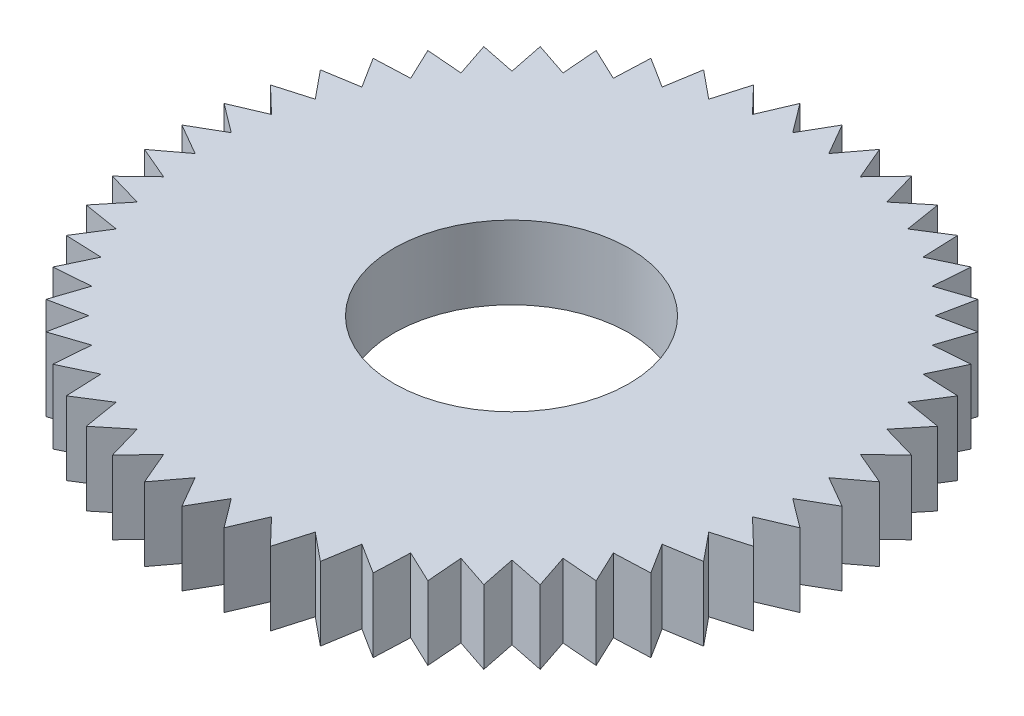
from build123d import *

# Parameters (mm, degrees)
SKETCH1_R           = 4
BOSS_EXTRUDE1_DEPTH = 2.5


with BuildPart() as part:
    # Sketch1 → Boss-Extrude1 (new body)
    with BuildSketch(Plane(origin=(0, 0, 0), x_dir=(1, 0, 0), z_dir=(0, 1, 0))):
        Polygon((0, 11.2593364), (-0.615569479, 10.193138786), (-1.355166685, 11.177363917), (-1.837732048, 10.044741383), (-2.690571988, 10.932641813), (-3.033096346, 9.750110546), (-3.986742692, 10.528738687), (-4.184231269, 9.313542654), (-5.224777711, 9.971544355), (-5.274350679, 8.741403853), (-6.386623706, 9.269183966), (-6.287558178, 8.042037212), (-7.455338345, 8.431899516), (-7.209078921, 7.225641073), (-8.415337364, 7.471900497), (-8.02547506, 6.30412033), (-9.252621814, 6.403185858), (-8.7248417, 5.290912831), (-9.954982203, 5.241339863), (-9.296980502, 4.200793422), (-10.512176534, 4.003304844), (-9.733548394, 3.049658499), (-10.916079661, 2.70713414), (-10.028179231, 1.854294201), (-11.160801765, 1.371728837), (-10.176576634, 0.632131631), (-11.242774248, 0.016562152), (-10.176576634, -0.599007327), (-11.160801765, -1.338604532), (-10.028179231, -1.821169896), (-10.916079661, -2.674009835), (-9.733548394, -3.016534194), (-10.512176534, -3.97018054), (-9.296980502, -4.167669117), (-9.954982203, -5.208215559), (-8.7248417, -5.257788526), (-9.252621814, -6.370061553), (-8.02547506, -6.270996026), (-8.415337364, -7.438776193), (-7.209078921, -7.192516769), (-7.455338345, -8.398775211), (-6.287558178, -8.008912907), (-6.386623706, -9.236059661), (-5.274350679, -8.708279548), (-5.224777711, -9.93842005), (-4.184231269, -9.28041835), (-3.986742692, -10.495614382), (-3.033096346, -9.716986241), (-2.690571988, -10.899517509), (-1.837732048, -10.011617079), (-1.355166685, -11.144239613), (-0.615569479, -10.160014482), (0, -11.226212095), (0.615569479, -10.160014482), (1.355166685, -11.144239613), (1.837732048, -10.011617079), (2.690571988, -10.899517509), (3.033096346, -9.716986241), (3.986742692, -10.495614382), (4.184231269, -9.28041835), (5.224777711, -9.93842005), (5.274350679, -8.708279548), (6.386623706, -9.236059661), (6.287558178, -8.008912907), (7.455338345, -8.398775211), (7.209078921, -7.192516769), (8.415337364, -7.438776193), (8.02547506, -6.270996026), (9.252621814, -6.370061553), (8.7248417, -5.257788526), (9.954982203, -5.208215559), (9.296980502, -4.167669117), (10.512176534, -3.97018054), (9.733548394, -3.016534194), (10.916079661, -2.674009835), (10.028179231, -1.821169896), (11.160801765, -1.338604532), (10.176576634, -0.599007327), (11.242774248, 0.016562152), (10.176576634, 0.632131631), (11.160801765, 1.371728837), (10.028179231, 1.854294201), (10.916079661, 2.70713414), (9.733548394, 3.049658499), (10.512176534, 4.003304844), (9.296980502, 4.200793422), (9.954982203, 5.241339863), (8.7248417, 5.290912831), (9.252621814, 6.403185858), (8.02547506, 6.30412033), (8.415337364, 7.471900497), (7.209078921, 7.225641073), (7.455338345, 8.431899516), (6.287558178, 8.042037212), (6.386623706, 9.269183966), (5.274350679, 8.741403853), (5.224777711, 9.971544355), (4.184231269, 9.313542654), (3.986742692, 10.528738687), (3.033096346, 9.750110546), (2.690571988, 10.932641813), (1.837732048, 10.044741383), (1.355166685, 11.177363917), (0.615569479, 10.193138786), align=None)
        Circle(SKETCH1_R, mode=Mode.SUBTRACT)
    extrude(amount=BOSS_EXTRUDE1_DEPTH)


solid = part.part
